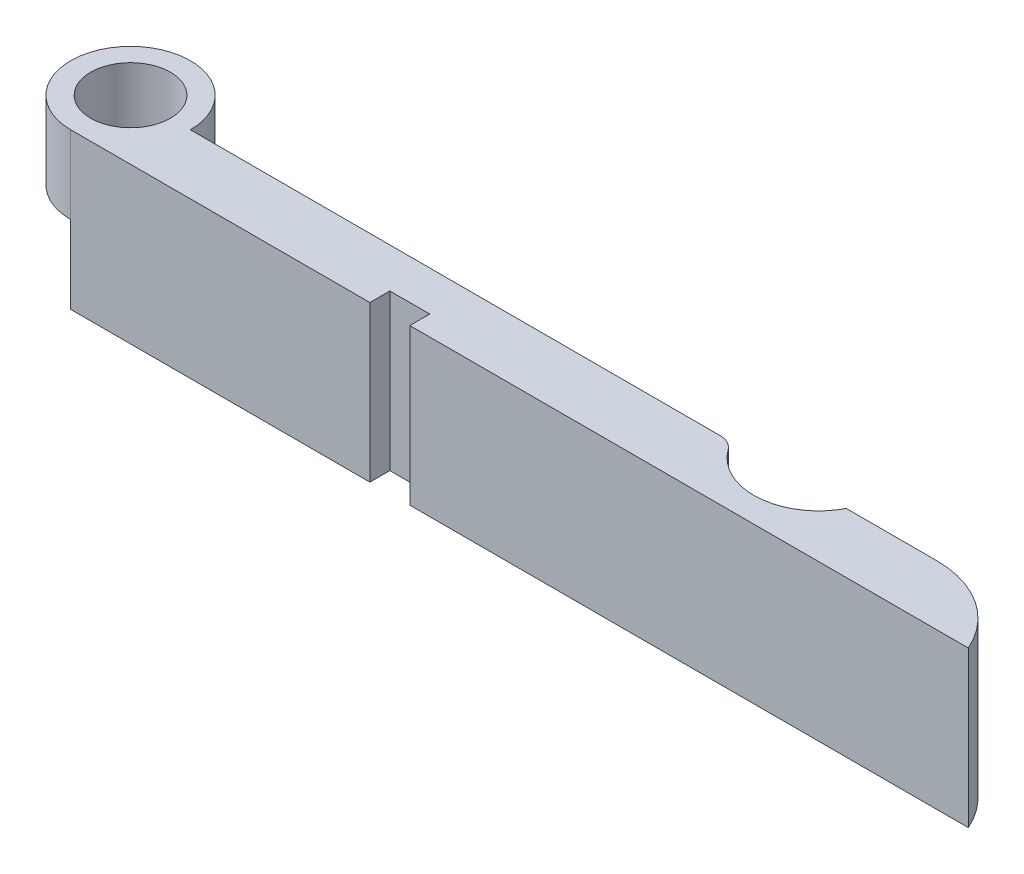
from build123d import *

# Parameters (mm, degrees)
CROQUIS1_R                   = 3
CROQUIS1_R_2                 = 2
SALIENTE_EXTRUIR1_DEPTH      = 3.9
SALIENTE_EXTRUIR2_DEPTH      = 3.9
SALIENTE_EXTRUIR2_DEPTH_BACK = 3.9
REDONDEO1_R                  = 5
CROQUIS4_W                   = 2
CROQUIS4_H                   = 2
CORTAR_EXTRUIR1_DEPTH        = 46.769422107
CROQUIS5_R                   = 3.25
CORTAR_EXTRUIR2_DEPTH        = 46.769422107
REDONDEO3_R                  = 1


with BuildPart() as part:
    # Croquis1 → Saliente-Extruir1 (new body)
    with BuildSketch(Plane(origin=(0, 0, 0), x_dir=(1, 0, 0), z_dir=(0, 1, 0))):
        with Locations(Location((0, 0, 0), (0, 0, 270))):
            Circle(CROQUIS1_R)
        with Locations(Location((0, 0, 0), (0, 0, 270))):
            Circle(CROQUIS1_R_2, mode=Mode.SUBTRACT)
    extrude(amount=SALIENTE_EXTRUIR1_DEPTH)

    # Croquis3 → Saliente-Extruir2 (add, two sides: drawn at the far end of the back side and taken through both)
    with BuildSketch(Plane.XZ.offset(-SALIENTE_EXTRUIR2_DEPTH_BACK)):
        with BuildLine():
            Line((45, 3), (0, 3))
            ThreePointArc((0, 3), (2.121320344, 2.121320344), (3, 0))
            Line((3, 0), (45, 0))
            Line((45, 0), (45, 3))
        make_face()
    extrude(amount=SALIENTE_EXTRUIR2_DEPTH + SALIENTE_EXTRUIR2_DEPTH_BACK)

    # Redondeo1
    # the kernel refuses this fillet: 5 mm, written as the material it takes off along each edge
    with BuildSketch(Plane(origin=(45, 15.356439237, 0), x_dir=(-1, 0, 0), z_dir=(0, -1, 0))) as redondeo1_piece_1:
        with BuildLine():
            CenterArc((4.582575695, -5), REDONDEO1_R, 90, 66.421821522)
            Line((0, -3), (-0.091651514, -2.96))
            ThreePointArc((-0.091651514, -2.96), (-0.1, -1.5), (-0.1, 0))
            Line((-0.1, 0), (0, 0.1))
            Line((0, 0.1), (4.582575695, 0.1))
            Line((4.582575695, 0.1), (4.582575695, 0))
        make_face()
    extrude(amount=30.712878475, mode=Mode.SUBTRACT)

    # Croquis4 → Cortar-Extruir1 (cut, through all)
    with BuildSketch(Plane.XZ.offset(3.9)):
        with Locations((16, 3)):
            Rectangle(CROQUIS4_W, CROQUIS4_H)
    extrude(amount=-CORTAR_EXTRUIR1_DEPTH, mode=Mode.SUBTRACT)

    # Croquis5 → Cortar-Extruir2 (cut, through all)
    with BuildSketch(Plane.XZ.offset(3.9)):
        with Locations((33, -1.5)):
            Circle(CROQUIS5_R)
    extrude(amount=-CORTAR_EXTRUIR2_DEPTH, mode=Mode.SUBTRACT)

    # Redondeo3
    redondeo3_edges = [part.edges().sort_by_distance(p)[0] for p in [
        (30.116859351, 0, 0),
    ]]
    fillet(redondeo3_edges, radius=REDONDEO3_R)


solid = part.part
